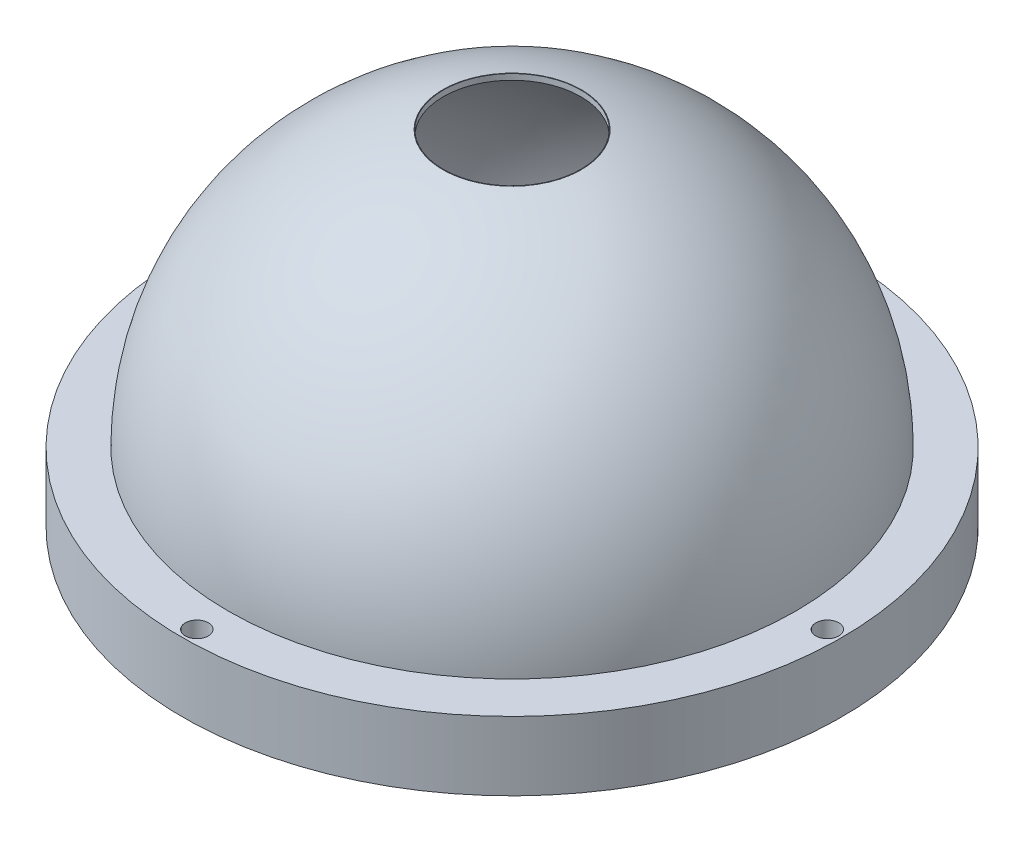
from build123d import *

# Parameters (mm, degrees)
CUT_EXTRUDE1_REACH  = 86.879
SKETCH2_R           = 12
SKETCH3_R           = 57.5
SKETCH3_R_2         = 48.5
BOSS_EXTRUDE1_DEPTH = 12
CUT_EXTRUDE2_REACH  = 103.057
SKETCH4_R           = 2


with BuildPart() as part:
    # Sketch1 → Revolve-Thin1 (revolve)
    with BuildSketch(Plane.XY):
        with BuildLine():
            Line((0, 47), (11.968709204, 47))
            ThreePointArc((11.968709204, 47), (38.293161246, 29.763800191), (48.5, 0))
            Line((48.5, 0), (49.5, 0))
            ThreePointArc((49.5, 0), (39.044030516, 30.427186546), (12.093386622, 48))
            Line((12.093386622, 48), (0, 48))
            Line((0, 48), (0, 47))
        make_face()
    revolve(axis=Axis((0, -100.538171033, 0), (0, 1, 0)))

    # Sketch2 → Cut-Extrude1 (cut, up to next)
    with BuildSketch(Plane(origin=(0, 48, 0), x_dir=(1, 0, 0), z_dir=(0, 1, 0)), mode=Mode.PRIVATE) as cut_extrude1_sk1:
        Circle(SKETCH2_R)
    cut_extrude1_tool1 = extrude(cut_extrude1_sk1.sketch, amount=-CUT_EXTRUDE1_REACH, mode=Mode.PRIVATE) & part.part
    add(cut_extrude1_tool1.solids().sort_by_distance((0, 48, 0))[0], mode=Mode.SUBTRACT)

    # Sketch3 → Boss-Extrude1 (add)
    with BuildSketch(Plane.XZ):
        Circle(SKETCH3_R)
        Circle(SKETCH3_R_2, mode=Mode.SUBTRACT)
    extrude(amount=BOSS_EXTRUDE1_DEPTH)

    # Sketch4 → Cut-Extrude2 (cut, up to next)
    with BuildSketch(Plane.XZ.offset(12), mode=Mode.PRIVATE) as cut_extrude2_sk1:
        with Locations((0, 55)):
            Circle(SKETCH4_R)
    cut_extrude2_tool1 = extrude(cut_extrude2_sk1.sketch, amount=-CUT_EXTRUDE2_REACH, mode=Mode.PRIVATE) & part.part
    # Sketch4 → Cut-Extrude2 (cut, up to next)
    with BuildSketch(Plane.XZ.offset(12), mode=Mode.PRIVATE) as cut_extrude2_sk2:
        with Locations((55, 0)):
            Circle(SKETCH4_R)
    cut_extrude2_tool2 = extrude(cut_extrude2_sk2.sketch, amount=-CUT_EXTRUDE2_REACH, mode=Mode.PRIVATE) & part.part
    # Sketch4 → Cut-Extrude2 (cut, up to next)
    with BuildSketch(Plane.XZ.offset(12), mode=Mode.PRIVATE) as cut_extrude2_sk3:
        with Locations((-55, 0)):
            Circle(SKETCH4_R)
    cut_extrude2_tool3 = extrude(cut_extrude2_sk3.sketch, amount=-CUT_EXTRUDE2_REACH, mode=Mode.PRIVATE) & part.part
    # Sketch4 → Cut-Extrude2 (cut, up to next)
    with BuildSketch(Plane.XZ.offset(12), mode=Mode.PRIVATE) as cut_extrude2_sk4:
        with Locations((0, -55)):
            Circle(SKETCH4_R)
    cut_extrude2_tool4 = extrude(cut_extrude2_sk4.sketch, amount=-CUT_EXTRUDE2_REACH, mode=Mode.PRIVATE) & part.part
    add(cut_extrude2_tool1.solids().sort_by_distance((0, -12, 55))[0], mode=Mode.SUBTRACT)
    add(cut_extrude2_tool2.solids().sort_by_distance((55, -12, 0))[0], mode=Mode.SUBTRACT)
    add(cut_extrude2_tool3.solids().sort_by_distance((-55, -12, 0))[0], mode=Mode.SUBTRACT)
    add(cut_extrude2_tool4.solids().sort_by_distance((0, -12, -55))[0], mode=Mode.SUBTRACT)


solid = part.part
